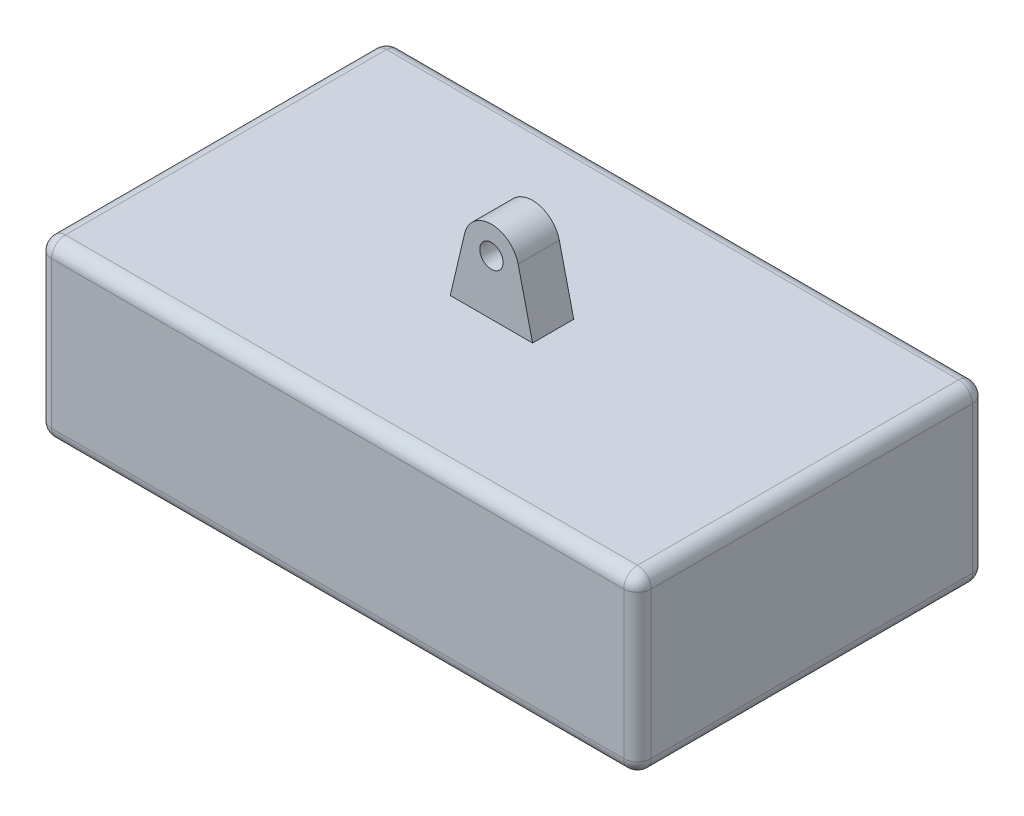
from build123d import *

# Parameters (mm, degrees)
SKETCH1_W           = 218.44
SKETCH1_H           = 127
BOSS_EXTRUDE1_DEPTH = 63.5
SKETCH2_W           = 30
SKETCH2_H           = 15
BOSS_EXTRUDE2_DEPTH = 30
CUT_EXTRUDE1_REACH  = 162.35
SKETCH3_R           = 4.25
FILLET1_R           = 5


with BuildPart() as part:
    # Sketch1 → Boss-Extrude1 (new body)
    with BuildSketch(Plane(origin=(0, 0, 0), x_dir=(1, 0, 0), z_dir=(0, 1, 0))):
        Rectangle(SKETCH1_W, SKETCH1_H)
    extrude(amount=BOSS_EXTRUDE1_DEPTH)

    # Sketch2 → Boss-Extrude2 (add)
    with BuildSketch(Plane(origin=(0, 63.5, 0), x_dir=(1, 0, 0), z_dir=(0, 1, 0))):
        Rectangle(SKETCH2_W, SKETCH2_H)
    extrude(amount=BOSS_EXTRUDE2_DEPTH)

    # Sketch3 → Cut-Extrude1 (cut, up to next)
    with BuildSketch(Plane(origin=(0, 0, -7.5), x_dir=(-1, 0, 0), z_dir=(0, 0, -1)), mode=Mode.PRIVATE) as cut_extrude1_sk1:
        with BuildLine():
            Line((15, 93.5), (0, 93.5))
            ThreePointArc((0, 93.5), (6.205203126, 91.341903734), (9.732121112, 85.799090834))
            Line((9.732121112, 85.799090834), (15, 63.5))
            Line((15, 63.5), (15, 93.5))
        make_face()
    cut_extrude1_tool1 = extrude(cut_extrude1_sk1.sketch, amount=-CUT_EXTRUDE1_REACH, mode=Mode.PRIVATE) & part.part
    # Sketch3 → Cut-Extrude1 (cut, up to next)
    with BuildSketch(Plane(origin=(0, 0, -7.5), x_dir=(-1, 0, 0), z_dir=(0, 0, -1)), mode=Mode.PRIVATE) as cut_extrude1_sk2:
        with BuildLine():
            ThreePointArc((-9.732121112, 85.799090834), (-6.205203126, 91.341903734), (0, 93.5))
            Line((0, 93.5), (-15, 93.5))
            Line((-15, 93.5), (-15, 63.5))
            Line((-15, 63.5), (-9.732121112, 85.799090834))
        make_face()
    cut_extrude1_tool2 = extrude(cut_extrude1_sk2.sketch, amount=-CUT_EXTRUDE1_REACH, mode=Mode.PRIVATE) & part.part
    # Sketch3 → Cut-Extrude1 (cut, up to next)
    with BuildSketch(Plane(origin=(0, 0, -7.5), x_dir=(-1, 0, 0), z_dir=(0, 0, -1)), mode=Mode.PRIVATE) as cut_extrude1_sk3:
        with Locations((0, 83.5)):
            Circle(SKETCH3_R)
    cut_extrude1_tool3 = extrude(cut_extrude1_sk3.sketch, amount=-CUT_EXTRUDE1_REACH, mode=Mode.PRIVATE) & part.part
    add(cut_extrude1_tool1.solids().sort_by_distance((-12.015946, 84.357088, -7.5))[0], mode=Mode.SUBTRACT)
    add(cut_extrude1_tool2.solids().sort_by_distance((12.015946, 84.357088, -7.5))[0], mode=Mode.SUBTRACT)
    add(cut_extrude1_tool3.solids().sort_by_distance((0, 83.5, -7.5))[0], mode=Mode.SUBTRACT)

    # Fillet1
    fillet1_edges = [part.edges().sort_by_distance(p)[0] for p in [
        (0, 0, 63.5),
        (109.22, 0, 0),
        (0, 0, -63.5),
        (-109.22, 0, 0),
        (0, 63.5, 63.5),
        (109.22, 63.5, 0),
        (0, 63.5, -63.5),
        (-109.22, 63.5, 0),
        (109.22, 31.75, -63.5),
        (109.22, 31.75, 63.5),
        (-109.22, 31.75, 63.5),
        (-109.22, 31.75, -63.5),
    ]]
    fillet(fillet1_edges, radius=FILLET1_R)


solid = part.part
